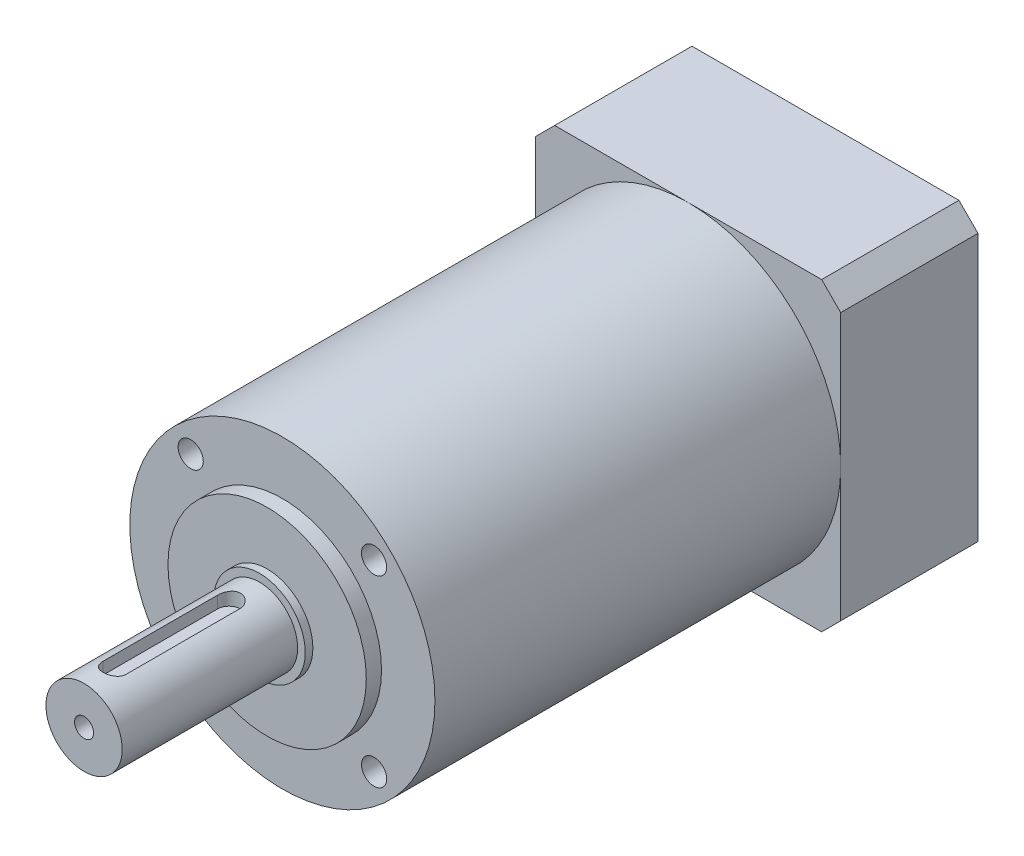
from build123d import *

# Parameters (mm, degrees)
SKETCH_1_W               = 40
SKETCH_1_H               = 40
EXTRUDE_1_DEPTH          = 18
SKETCH_2_R               = 20
EXTRUDE_2_DEPTH          = 53.2
SKETCH_3_R               = 13
EXTRUDE_3_DEPTH          = 2
SKETCH_4_R               = 6
EXTRUDE_4_DEPTH          = 1
SKETCH_5_R               = 5
EXTRUDE_5_DEPTH          = 23
CUT_EXTRUDE_1_DEPTH      = 1.8
HOLE_WIZARD_M31_D        = 2.5
HOLE_WIZARD_M31_DEPTH    = 15
HOLE_WIZARD_M31_TIP      = 0.751075774
PATTERN_CIRCULAR_1_COUNT = 4
CHAMFER_1_SIZE           = 2.5
SKETCH_15_R              = 16.5
CUT_EXTRUDE_2_DEPTH      = 18
EXTRUDE_6_DEPTH          = 15
FILLET_1_R               = 0.5
SKETCH_17_R              = 13.5
SKETCH_17_R_2            = 9
EXTRUDE_7_DEPTH          = 16
FILLET_2_R               = 0.5
PATTERN_CIRCULAR_2_COUNT = 4


with BuildPart() as part:
    # Эскиз1 → Бобышка-Вытянуть1 (new body)
    with BuildSketch(Plane.XY):
        with Locations((20, 20)):
            Rectangle(SKETCH_1_W, SKETCH_1_H)
    extrude(amount=EXTRUDE_1_DEPTH)

    # Эскиз2 → Бобышка-Вытянуть2 (add)
    with BuildSketch(Plane.XY.offset(18)):
        with Locations((20, 20)):
            Circle(SKETCH_2_R)
    extrude(amount=EXTRUDE_2_DEPTH)

    # Эскиз3 → Бобышка-Вытянуть3 (add)
    with BuildSketch(Plane.XY.offset(71.2)):
        with Locations((20, 20)):
            Circle(SKETCH_3_R)
    extrude(amount=EXTRUDE_3_DEPTH)

    # Эскиз4 → Бобышка-Вытянуть4 (add)
    with BuildSketch(Plane.XY.offset(73.2)):
        with Locations((20, 20)):
            Circle(SKETCH_4_R)
    extrude(amount=EXTRUDE_4_DEPTH)

    # Эскиз5 → Бобышка-Вытянуть5 (add)
    with BuildSketch(Plane.XY.offset(74.2)):
        with Locations((20, 20)):
            Circle(SKETCH_5_R)
    extrude(amount=EXTRUDE_5_DEPTH)

    # Эскиз9 → Вырез-Вытянуть1 (cut)
    with BuildSketch(Plane(origin=(0, 25, 0), x_dir=(-1, 0, 0), z_dir=(0, -1, 0))):
        with BuildLine():
            Line((-21.5, -93.2), (-21.5, -78.2))
            ThreePointArc((-21.5, -78.2), (-20, -76.7), (-18.5, -78.2))
            Line((-18.5, -78.2), (-18.5, -93.2))
            ThreePointArc((-18.5, -93.2), (-20, -94.7), (-21.5, -93.2))
        make_face()
    extrude(amount=CUT_EXTRUDE_1_DEPTH, mode=Mode.SUBTRACT)

    # Отверстие обработанное метчиком M31
    with Locations(Plane.XY.offset(97.2)):
        with Locations((20, 20)):
            Hole(HOLE_WIZARD_M31_D / 2, depth=HOLE_WIZARD_M31_DEPTH)
            with Locations((0, 0, -(HOLE_WIZARD_M31_DEPTH + HOLE_WIZARD_M31_TIP / 2))):  # 118° drill point
                Cone(0, HOLE_WIZARD_M31_D / 2, HOLE_WIZARD_M31_TIP, mode=Mode.SUBTRACT)

    # Эскиз14 → Отверстие обработанное метчиком M41 (revolve, cut)
    with BuildSketch(Plane(origin=(7.97918472, 32.02081528, 71.2), x_dir=(0, -1, 0), z_dir=(1, 0, 0))):
        Polygon((0, 0), (0, 7.991420021), (1.65, 7), (1.65, 0), align=None)
    hole_wizard_m41 = revolve(axis=Axis((7.97918472, 32.02081528, 77.55), (0, 0, -1)), mode=Mode.SUBTRACT)

    # Круговой массив1: Отверстие обработанное метчиком M41 ×4 about axis
    pattern_circular_1_axis = Axis((20, 20, 71.2), (0, 0, 1))
    for i in range(1, PATTERN_CIRCULAR_1_COUNT):
        add(hole_wizard_m41.rotate(pattern_circular_1_axis, i * 360 / PATTERN_CIRCULAR_1_COUNT), mode=Mode.SUBTRACT)

    # Фаска1
    chamfer_1_edges = [part.edges().sort_by_distance(p)[0] for p in [
        (0, 0, 9),
        (40, 0, 9),
        (40, 40, 9),
        (0, 40, 9),
    ]]
    chamfer(chamfer_1_edges, length=CHAMFER_1_SIZE)

    # Эскиз15 → Вырез-Вытянуть2 (cut)
    with BuildSketch(Plane(origin=(0, 0, 0), x_dir=(-1, 0, 0), z_dir=(0, 0, -1))):
        with Locations((-20, 20)):
            Circle(SKETCH_15_R)
    extrude(amount=-CUT_EXTRUDE_2_DEPTH, mode=Mode.SUBTRACT)

    # Эскиз16 → Бобышка-Вытянуть6 (add)
    with BuildSketch(Plane(origin=(0, 0, 18), x_dir=(-1, 0, 0), z_dir=(0, 0, -1))):
        with BuildLine():
            Line((-21, 14.591673087), (-21, 11.05572809))
            ThreePointArc((-21, 11.05572809), (-20, 29), (-19, 11.05572809))
            Line((-19, 11.05572809), (-19, 14.591673087))
            ThreePointArc((-19, 14.591673087), (-20, 25.5), (-21, 14.591673087))
        make_face()
    extrude(amount=EXTRUDE_6_DEPTH)

    # Скругление1
    fillet_1_edges = [part.edges().sort_by_distance(p)[0] for p in [
        (20, 25.5, 3),
        (20, 29, 3),
    ]]
    fillet(fillet_1_edges, radius=FILLET_1_R)

    # Эскиз17 → Бобышка-Вытянуть7 (add)
    with BuildSketch(Plane(origin=(0, 0, 18), x_dir=(-1, 0, 0), z_dir=(0, 0, -1))):
        with Locations((-20, 20)):
            Circle(SKETCH_17_R)
        with Locations((-20, 20)):
            Circle(SKETCH_17_R_2, mode=Mode.SUBTRACT)
    extrude(amount=EXTRUDE_7_DEPTH)

    # Скругление2
    fillet_2_edges = [part.edges().sort_by_distance(p)[0] for p in [
        (29, 20, 2),
    ]]
    fillet(fillet_2_edges, radius=FILLET_2_R)

    # Эскиз20 → Отверстие обработанное метчиком M42 (revolve, cut)
    with BuildSketch(Plane(origin=(4.444783043, 35.555216957, 0), x_dir=(0, 1, 0), z_dir=(1, 0, 0))):
        Polygon((0, 0), (0, 11.491420021), (1.65, 10.5), (1.65, 0), align=None)
    hole_wizard_m42 = revolve(axis=Axis((4.444783043, 35.555216957, -6.35), (0, 0, 1)), mode=Mode.SUBTRACT)

    # Круговой массив2: Отверстие обработанное метчиком M42 ×4 about axis
    pattern_circular_2_axis = Axis((20, 20, 18), (0, 0, -1))
    for i in range(1, PATTERN_CIRCULAR_2_COUNT):
        add(hole_wizard_m42.rotate(pattern_circular_2_axis, i * 360 / PATTERN_CIRCULAR_2_COUNT), mode=Mode.SUBTRACT)


solid = part.part
